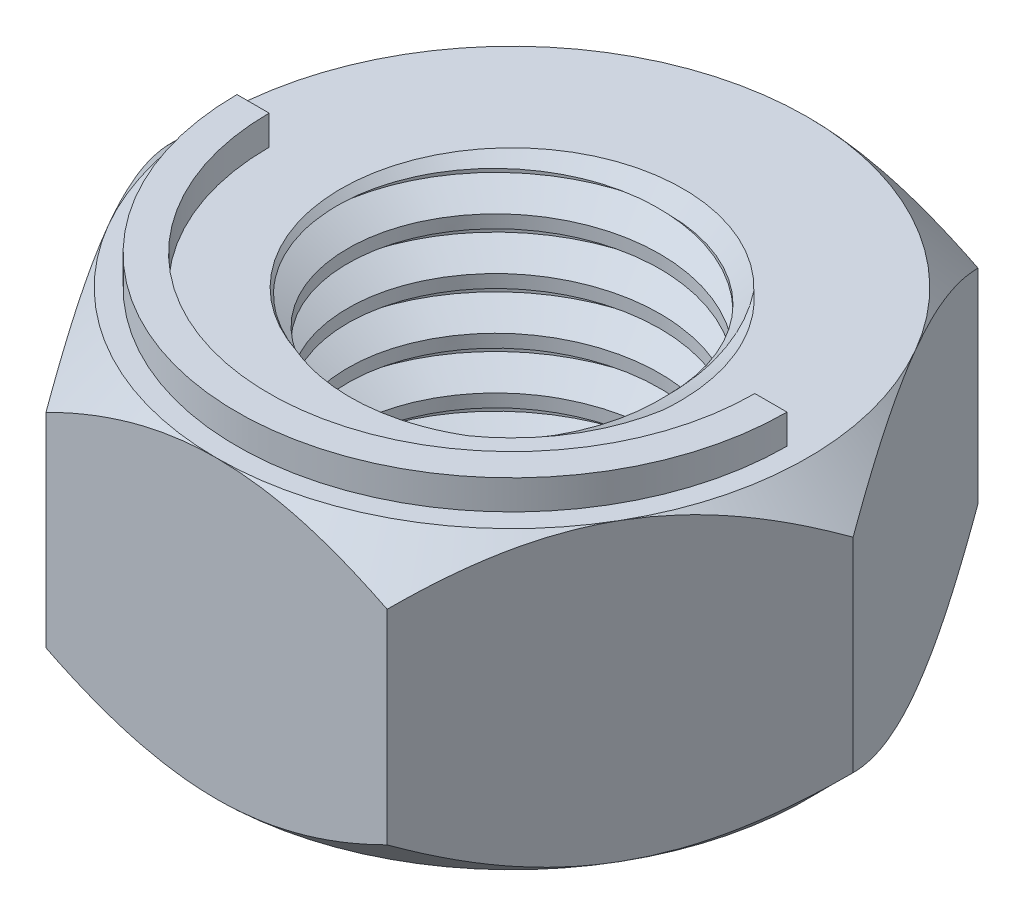
from build123d import *

# Parameters (mm, degrees)
BOSS_EXTRUDE2_DEPTH = 5
SKETCH4_OUTSIDE_W   = 51.524
SKETCH4_OUTSIDE_H   = 48.43
SKETCH4_OUTSIDE_R   = 10
CUT_EXTRUDE2_DEPTH  = 10
CUT_EXTRUDE2_TAPER  = 45
SKETCH5_R           = 5.29
CUT_EXTRUDE3_DEPTH  = 10
CHAMFER1_SIZE       = 0.5
THREAD1_PITCH       = 1.75
BOSS_EXTRUDE3_DEPTH = 1


with BuildPart() as part:
    # Sketch1 → Boss-Extrude2 (new, symmetric)
    with BuildSketch(Plane(origin=(0, 0, 0), x_dir=(1, 0, 0), z_dir=(0, 1, 0))):
        Polygon((11.547005384, 0), (5.773502692, 10), (-5.773502692, 10), (-11.547005384, 0), (-5.773502692, -10), (5.773502692, -10), align=None)
    extrude(amount=BOSS_EXTRUDE2_DEPTH, both=True)

    # Sketch4 outside → Cut-Extrude2 (cut)
    with BuildSketch(Plane(origin=(0, 5, 0), x_dir=(1, 0, 0), z_dir=(0, 1, 0))):
        Rectangle(SKETCH4_OUTSIDE_W, SKETCH4_OUTSIDE_H)
        Circle(SKETCH4_OUTSIDE_R, mode=Mode.SUBTRACT)
    cut_extrude2 = extrude(amount=-CUT_EXTRUDE2_DEPTH, taper=CUT_EXTRUDE2_TAPER, mode=Mode.SUBTRACT)

    # Mirror2: Cut-Extrude2 across plane
    add(cut_extrude2.mirror(Plane.ZX), mode=Mode.SUBTRACT)

    # Sketch5 → Cut-Extrude3 (cut)
    with BuildSketch(Plane(origin=(0, 5, 0), x_dir=(1, 0, 0), z_dir=(0, 1, 0))):
        with Locations(Location((0, 0, 0), (0, 0, 270))):
            Circle(SKETCH5_R)
    extrude(amount=-CUT_EXTRUDE3_DEPTH, mode=Mode.SUBTRACT)

    # Chamfer1
    chamfer1_edges = [part.edges().sort_by_distance(p)[0] for p in [
        (0, -5, -5.29),
        (0, 5, -5.29),
    ]]
    chamfer(chamfer1_edges, length=CHAMFER1_SIZE)

    # Thread1: arcs per turn and ends read off the stored shape
    # Thread1: the profile of Thread Profile1 profile screwed along a right-hand helix through 10.857142 turns, 10 arcs to a turn; built about Z, then put on its axis
    thread1_z = Axis((0, 0, 0), (0, 0, 1))
    thread1_corners = [(5.2897, 0, -0.000173205), (6.237215281, 0, 0.546874998), (6.237215281, 0, 0.765624998), (5.2897, 0, 1.3126732)]
    with BuildLine(mode=Mode.PRIVATE) as thread1_profile:
        Line(thread1_corners[0], thread1_corners[1])
        Line(thread1_corners[1], thread1_corners[2])
        Line(thread1_corners[2], thread1_corners[3])
        Line(thread1_corners[3], thread1_corners[0])
    thread1_cap = Face(thread1_profile.wire())
    thread1_turn_angles = [0, 18, 36, 54, 72, 90, 108, 126, 144, 162, 180, 198, 216, 234, 252, 270, 288, 306, 324, 342, 360]
    thread1_turn_weights = [1, 0.9510565162951535, 1, 0.9510565162951535, 1, 0.9510565162951535, 1, 0.9510565162951535, 1, 0.9510565162951535, 1, 0.9510565162951535, 1, 0.9510565162951535, 1, 0.9510565162951535, 1, 0.9510565162951535, 1, 0.9510565162951535, 1]
    thread1_turn_rails = [Edge.make_bspline([Vector(p[0], p[1], 0).rotate(thread1_z, thread1_turn_angles[k]) / thread1_turn_weights[k] + Vector(0, 0, p[2] + THREAD1_PITCH * thread1_turn_angles[k] / 360) for k in range(21)], [0, 0, 0, 1, 1, 2, 2, 3, 3, 4, 4, 5, 5, 6, 6, 7, 7, 8, 8, 9, 9, 10, 10, 10], 2, thread1_turn_weights) for p in thread1_corners]
    thread1_turn_sides = [Face.make_surface_from_curves(thread1_turn_rails[p[0]], thread1_turn_rails[p[1]]) for p in [(0, 1), (1, 2), (2, 3), (3, 0)]]
    thread1_last_angles = [3600, 3618, 3636, 3654, 3672, 3690, 3708, 3726, 3744, 3762, 3780, 3798, 3816, 3834, 3852, 3870, 3888, 3898.2855, 3908.571]
    thread1_last_weights = [1, 0.9510565162951535, 1, 0.9510565162951535, 1, 0.9510565162951535, 1, 0.9510565162951535, 1, 0.9510565162951535, 1, 0.9510565162951535, 1, 0.9510565162951535, 1, 0.9510565162951535, 1, 0.9839302563929734, 1]
    thread1_last_rails = [Edge.make_bspline([Vector(p[0], p[1], 0).rotate(thread1_z, thread1_last_angles[k]) / thread1_last_weights[k] + Vector(0, 0, p[2] + THREAD1_PITCH * thread1_last_angles[k] / 360) for k in range(19)], [0, 0, 0, 1, 1, 2, 2, 3, 3, 4, 4, 5, 5, 6, 6, 7, 7, 8, 8, 9, 9, 9], 2, thread1_last_weights) for p in thread1_corners]
    thread1_last_sides = [Face.make_surface_from_curves(thread1_last_rails[p[0]], thread1_last_rails[p[1]]) for p in [(0, 1), (1, 2), (2, 3), (3, 0)]]
    thread1 = Plane(origin=(0, -9.5, 0), x_dir=(1, 0, 0), z_dir=(0, 1, 0)) * Solid(Shell([*[p.moved(Location((0, 0, THREAD1_PITCH * i))) for i in range(10) for p in thread1_turn_sides], *thread1_last_sides, thread1_cap, thread1_cap.rotate(thread1_z, 3908.571).moved(Location((0, 0, THREAD1_PITCH * 3908.571 / 360)))]))
    add(thread1, mode=Mode.SUBTRACT)

    # Boss-Extrude3: read off the stored shape, not the designer's step
    # Boss-Extrude3 outline → Boss-Extrude3 (add)
    with BuildSketch(Plane(origin=(0, 5, 0), x_dir=(1, 0, 0), z_dir=(0, 1, 0))):
        with BuildLine():
            Line((9.308825352, 0), (8.220416171, 0))
            ThreePointArc((8.220416171, 0), (0, -8.220416171), (-8.220416171, 0))
            Line((-8.220416171, 0), (-9.308825352, 0))
            ThreePointArc((-9.308825352, 0), (0, -9.308825352), (9.308825352, 0))
        make_face()
    extrude(amount=BOSS_EXTRUDE3_DEPTH)


solid = part.part
